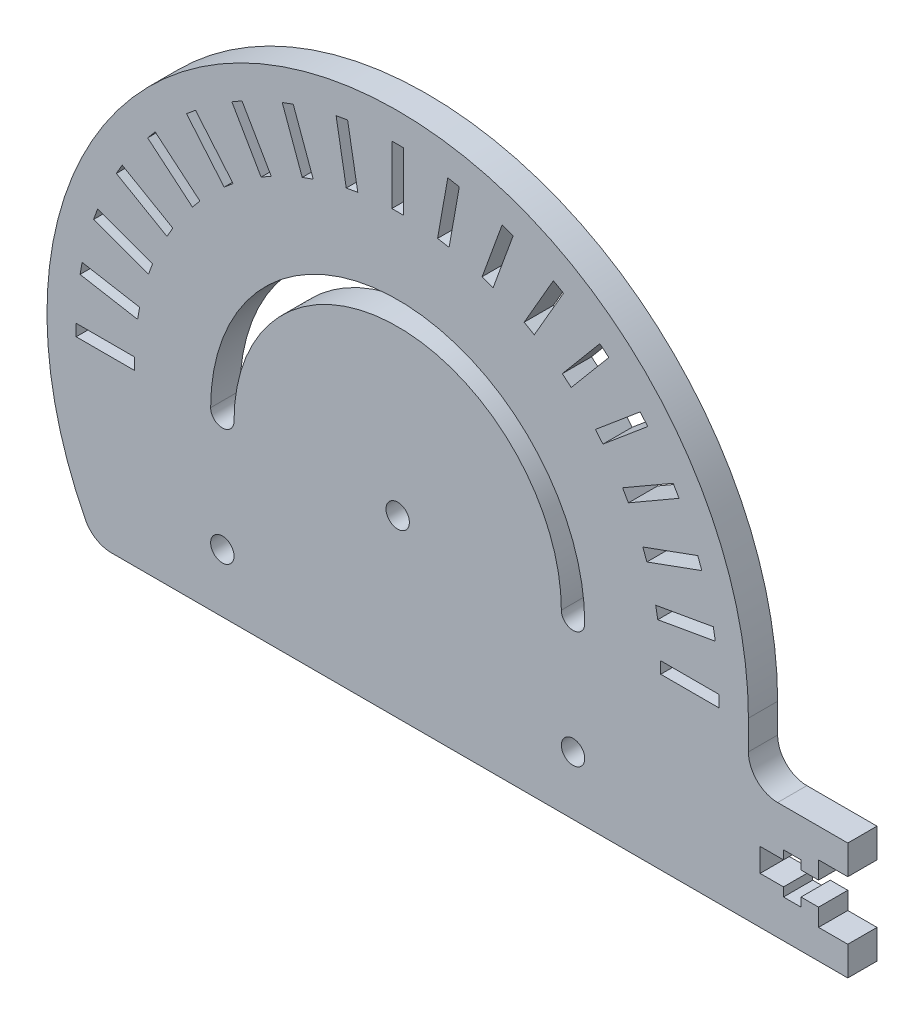
from build123d import *

# Parameters (mm, degrees)
BOSS_EXTRU_1_OUTLINE_R   = 2
BOSS_EXTRU_1_OUTLINE_W   = 10
BOSS_EXTRU_1_OUTLINE_H   = 2
BOSS_EXTRU_1_OUTLINE_W_2 = 2
BOSS_EXTRU_1_OUTLINE_H_2 = 10
BOSS_EXTRU_1_DEPTH       = 5
BOSS_EXTRU_2_DEPTH       = 5
CONG_1_R                 = 5


with BuildPart() as part:
    # Boss.-Extru.1: read off the stored shape, not the designer's step
    # Boss.-Extru.1 outline → Boss.-Extru.1 (new body)
    with BuildSketch(Plane.XY):
        with BuildLine():
            ThreePointArc((60, 0), (-15.529142706, 57.955549577), (-51.961524227, -30))
            Line((-51.961524227, -30), (60, -30))
            Line((60, -30), (60, 0))
        make_face()
        with Locations((-30, -20)):
            Circle(BOSS_EXTRU_1_OUTLINE_R, mode=Mode.SUBTRACT)
        with Locations((-50, 0)):
            Rectangle(BOSS_EXTRU_1_OUTLINE_W, BOSS_EXTRU_1_OUTLINE_H, mode=Mode.SUBTRACT)
        Polygon((-53.990778238, 10.535457525), (-44.142700708, 8.798975748), (-44.489997063, 6.829360242), (-54.338074593, 8.565842019), align=None, mode=Mode.SUBTRACT)
        Circle(BOSS_EXTRU_1_OUTLINE_R, mode=Mode.SUBTRACT)
        with Locations((30, -20)):
            Circle(BOSS_EXTRU_1_OUTLINE_R, mode=Mode.SUBTRACT)
        with Locations((50, 0)):
            Rectangle(BOSS_EXTRU_1_OUTLINE_W, BOSS_EXTRU_1_OUTLINE_H, mode=Mode.SUBTRACT)
        Polygon((54.338074593, 8.565842019), (44.489997063, 6.829360242), (44.142700708, 8.798975748), (53.990778238, 10.535457525), align=None, mode=Mode.SUBTRACT)
        Polygon((-51.341074, 19.750800504), (-41.944147792, 16.33059907), (-42.628188079, 14.451213829), (-52.025114287, 17.871415262), align=None, mode=Mode.SUBTRACT)
        Polygon((-47.131397208, 28.366025404), (-38.47114317, 23.366025404), (-39.47114317, 21.633974596), (-48.131397208, 26.633974596), align=None, mode=Mode.SUBTRACT)
        Polygon((-41.489656762, 36.119362976), (-33.829212331, 29.691486879), (-35.11478755, 28.159397993), (-42.775231981, 34.58727409), align=None, mode=Mode.SUBTRACT)
        with BuildLine():
            ThreePointArc((-28, 0), (-30, -2), (-32, 0))
            ThreePointArc((-32, 0), (0, 32), (32, 0))
            ThreePointArc((32, 0), (30, -2), (28, 0))
            ThreePointArc((28, 0), (0, 28), (-28, 0))
        make_face(mode=Mode.SUBTRACT)
        Polygon((-34.58727409, 42.775231981), (-28.159397993, 35.11478755), (-29.691486879, 33.829212331), (-36.119362976, 41.489656762), align=None, mode=Mode.SUBTRACT)
        Polygon((-26.633974596, 48.131397208), (-21.633974596, 39.47114317), (-23.366025404, 38.47114317), (-28.366025404, 47.131397208), align=None, mode=Mode.SUBTRACT)
        Polygon((-17.871415262, 52.025114287), (-14.451213829, 42.628188079), (-16.33059907, 41.944147792), (-19.750800504, 51.341074), align=None, mode=Mode.SUBTRACT)
        Polygon((-8.565842019, 54.338074593), (-6.829360242, 44.489997063), (-8.798975748, 44.142700708), (-10.535457525, 53.990778238), align=None, mode=Mode.SUBTRACT)
        with Locations((0, 50)):
            Rectangle(BOSS_EXTRU_1_OUTLINE_W_2, BOSS_EXTRU_1_OUTLINE_H_2, mode=Mode.SUBTRACT)
        Polygon((48.131397208, 26.633974596), (39.47114317, 21.633974596), (38.47114317, 23.366025404), (47.131397208, 28.366025404), align=None, mode=Mode.SUBTRACT)
        Polygon((52.025114287, 17.871415262), (42.628188079, 14.451213829), (41.944147792, 16.33059907), (51.341074, 19.750800504), align=None, mode=Mode.SUBTRACT)
        Polygon((42.775231981, 34.58727409), (35.11478755, 28.159397993), (33.829212331, 29.691486879), (41.489656762, 36.119362976), align=None, mode=Mode.SUBTRACT)
        Polygon((19.750800504, 51.341074), (16.33059907, 41.944147792), (14.451213829, 42.628188079), (17.871415262, 52.025114287), align=None, mode=Mode.SUBTRACT)
        Polygon((28.366025404, 47.131397208), (23.366025404, 38.47114317), (21.633974596, 39.47114317), (26.633974596, 48.131397208), align=None, mode=Mode.SUBTRACT)
        Polygon((10.535457525, 53.990778238), (8.798975748, 44.142700708), (6.829360242, 44.489997063), (8.565842019, 54.338074593), align=None, mode=Mode.SUBTRACT)
        Polygon((36.119362976, 41.489656762), (29.691486879, 33.829212331), (28.159397993, 35.11478755), (34.58727409, 42.775231981), align=None, mode=Mode.SUBTRACT)
    extrude(amount=BOSS_EXTRU_1_DEPTH)

    # Esquisse2 → Boss.-Extru.2 (add)
    with BuildSketch(Plane.XY.offset(5)):
        Polygon((69, -22), (72, -22), (72, -25), (77, -25), (77, -30), (72, -30), (60, -30), (60, -10), (72, -10), (77, -10), (77, -15), (72, -15), (72, -18), (69, -18), (69, -16.5), (66, -16.5), (66, -18), (62, -18), (62, -22), (66, -22), (66, -23.5), (69, -23.5), align=None)
    extrude(amount=-BOSS_EXTRU_2_DEPTH)

    # Congé1
    cong_1_edges = [part.edges().sort_by_distance(p)[0] for p in [
        (-51.961524227, -30, 2.5),
        (60, -10, 2.5),
    ]]
    fillet(cong_1_edges, radius=CONG_1_R)


solid = part.part
